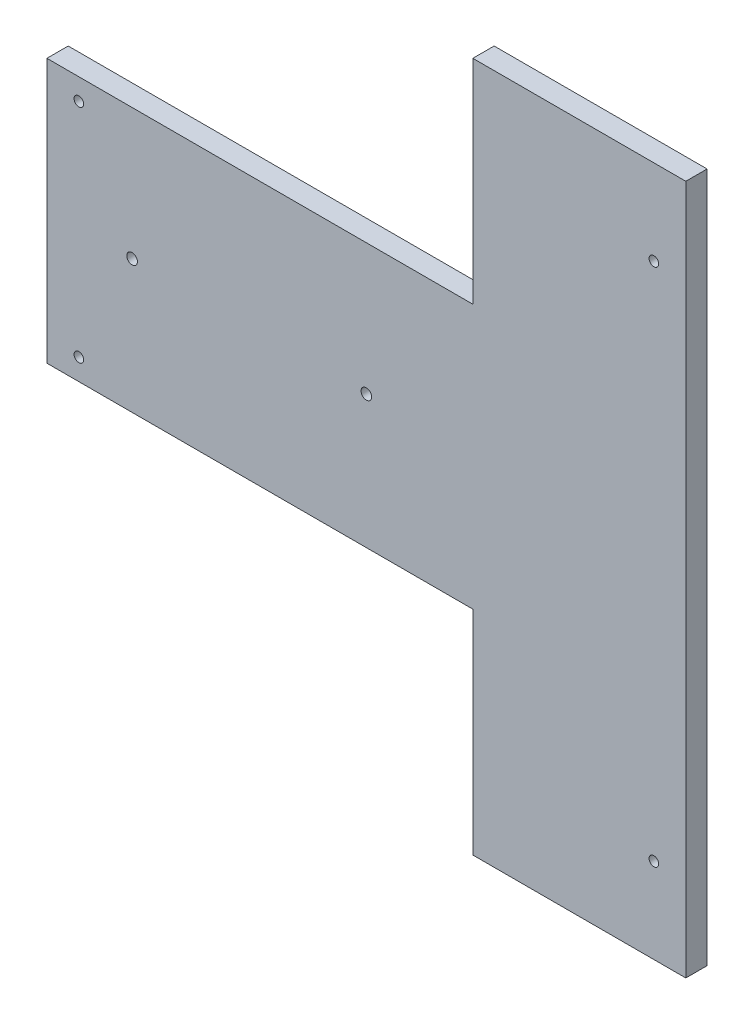
from build123d import *

# Parameters (mm, degrees)
BOSS_EXTRU_1_DEPTH      = 10
ESQUISSE2_R             = 2.25
ENL_V_MAT_EXTRU_1_DEPTH = 10
ESQUISSE3_R             = 2.5
ENL_V_MAT_EXTRU_2_DEPTH = 10


with BuildPart() as part:
    # Esquisse1 → Boss.-Extru.1 (new body)
    with BuildSketch(Plane.XY):
        Polygon((77.555428531, 41.935483871), (-122.444571469, 41.935483871), (-122.444571469, -82.064516129), (77.555428531, -82.064516129), (77.555428531, -182.064516129), (177.555428531, -182.064516129), (177.555428531, 141.935483871), (77.555428531, 141.935483871), align=None)
    extrude(amount=BOSS_EXTRU_1_DEPTH)

    # Esquisse2 → Enlèv. mat.-Extru.1 (cut)
    with BuildSketch(Plane(origin=(0, 0, 0), x_dir=(-1, 0, 0), z_dir=(0, 0, -1))):
        with Locations((-162.555428531, -142.064516129)):
            Circle(ESQUISSE2_R)
        with Locations((-162.555428531, 101.935483871)):
            Circle(ESQUISSE2_R)
        with Locations((107.444571469, 31.935483871)):
            Circle(ESQUISSE2_R)
        with Locations((107.444571469, -72.064516129)):
            Circle(ESQUISSE2_R)
    extrude(amount=-ENL_V_MAT_EXTRU_1_DEPTH, mode=Mode.SUBTRACT)

    # Esquisse3 → Enlèv. mat.-Extru.2 (cut)
    with BuildSketch(Plane(origin=(0, 0, 0), x_dir=(-1, 0, 0), z_dir=(0, 0, -1))):
        with Locations((-27.555428531, -19.564516129)):
            Circle(ESQUISSE3_R)
        with Locations((82.444571469, -19.564516129)):
            Circle(ESQUISSE3_R)
    extrude(amount=-ENL_V_MAT_EXTRU_2_DEPTH, mode=Mode.SUBTRACT)


solid = part.part
